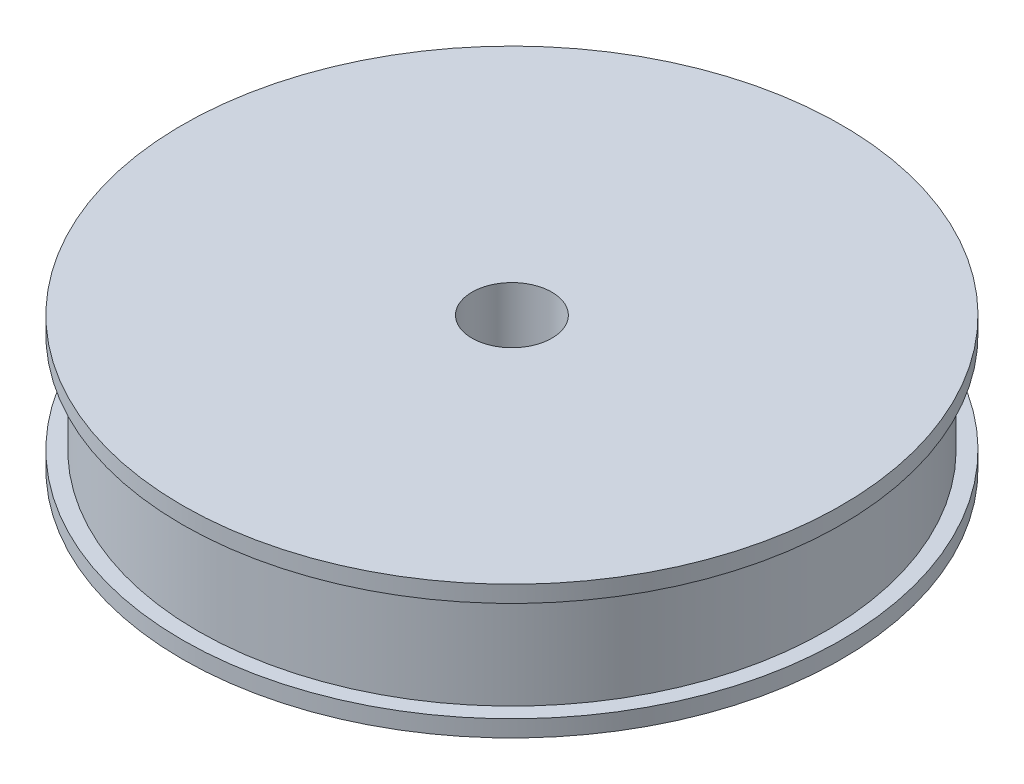
from build123d import *


with BuildPart() as part:
    # Schizzo1 → Rivoluzione1 (revolve)
    with BuildSketch(Plane.XY):
        Polygon((6, -7.661290323), (49.5, -7.661290323), (49.5, -5.161290323), (47.175, -5.161290323), (47.175, 9.838709677), (49.5, 9.838709677), (49.5, 12.338709677), (6, 12.338709677), align=None)
    revolve(axis=Axis((0, 12.338709677, 0), (0, -1, 0)))


solid = part.part
